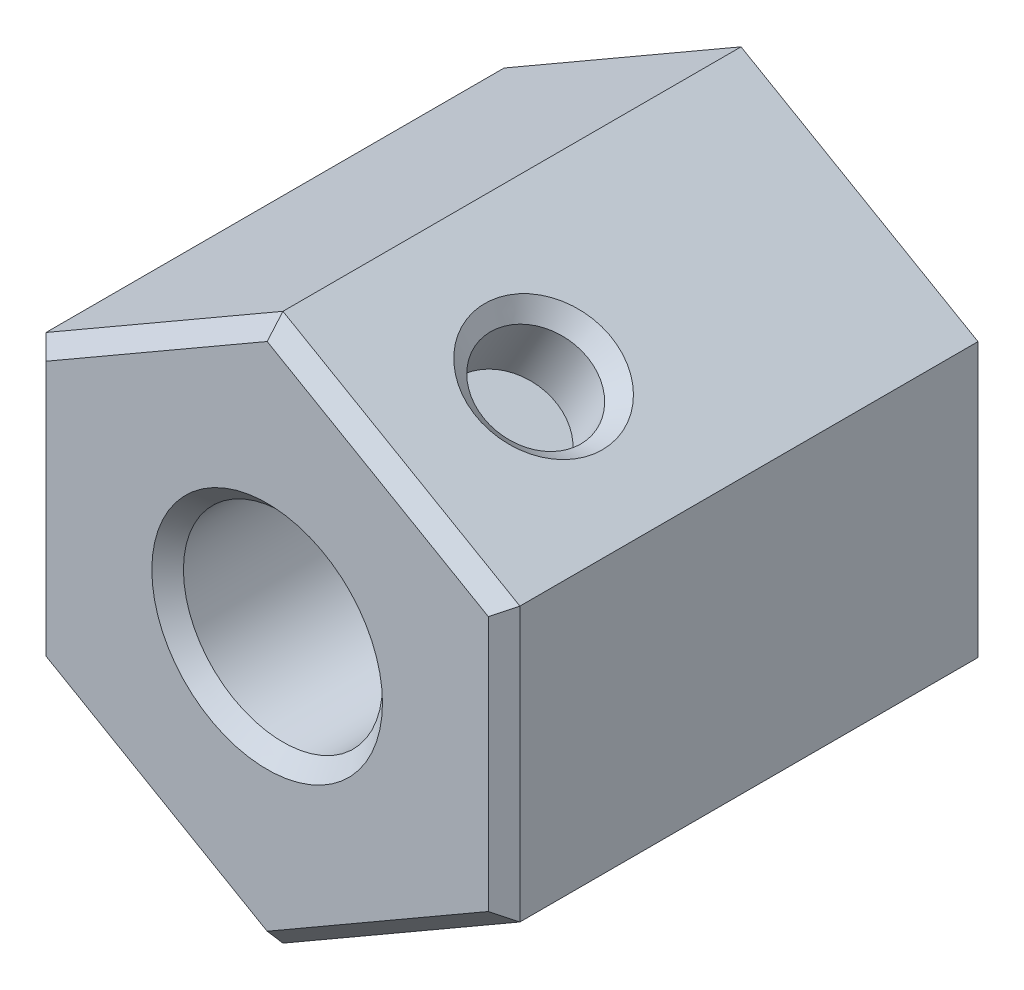
from build123d import *

# Parameters (mm, degrees)
BOSS_EXTRUDE1_DEPTH = 15
SKETCH2_R           = 3.15
CUT_EXTRUDE1_DEPTH  = 15
CUT_EXTRUDE2_DEPTH  = 2.5
SKETCH4_R           = 1.65
CUT_EXTRUDE3_DEPTH  = 2.5
CIRPATTERN1_COUNT   = 3
CHAMFER1_SIZE       = 0.5
CHAMFER2_SIZE       = 0.5
CHAMFER3_SIZE       = 0.5


with BuildPart() as part:
    # Sketch1 → Boss-Extrude1 (new body)
    with BuildSketch(Plane.XY):
        Polygon((0, 8.660254038), (-7.5, 4.330127019), (-7.5, -4.330127019), (0, -8.660254038), (7.5, -4.330127019), (7.5, 4.330127019), align=None)
    extrude(amount=BOSS_EXTRUDE1_DEPTH)

    # Sketch2 → Cut-Extrude1 (cut)
    with BuildSketch(Plane.XY.offset(15)):
        Circle(SKETCH2_R)
    extrude(amount=-CUT_EXTRUDE1_DEPTH, mode=Mode.SUBTRACT)

    # Sketch3 → Cut-Extrude2 (cut)
    with BuildSketch(Plane(origin=(0, 0, 0), x_dir=(-1, 0, 0), z_dir=(0, 0, -1))):
        Polygon((0, 5.888972746), (-5.1, 2.944486373), (-5.1, -2.944486373), (0, -5.888972746), (5.1, -2.944486373), (5.1, 2.944486373), align=None)
    extrude(amount=-CUT_EXTRUDE2_DEPTH, mode=Mode.SUBTRACT)

    # Sketch4 → Cut-Extrude3 (cut)
    with BuildSketch(Plane(origin=(3.75, 6.495190528, 0), x_dir=(0.8660254037844417, -0.4999999999999949, 0), z_dir=(0.4999999999999949, 0.8660254037844417, 0))):
        with Locations((0, -10)):
            Circle(SKETCH4_R)
    cut_extrude3 = extrude(amount=-CUT_EXTRUDE3_DEPTH, mode=Mode.SUBTRACT)

    # CirPattern1: Cut-Extrude3 ×3 about axis
    cirpattern1_axis = Axis((0, 0, 15), (0, 0, 1))
    for i in range(1, CIRPATTERN1_COUNT):
        add(cut_extrude3.rotate(cirpattern1_axis, i * 360 / CIRPATTERN1_COUNT), mode=Mode.SUBTRACT)

    # Chamfer1
    chamfer1_edges = [part.edges().sort_by_distance(p)[0] for p in [
        (7.5, 0, 15),
        (3.75, -6.495190528, 15),
        (-3.75, -6.495190528, 15),
        (-7.5, 0, 15),
        (-3.75, 6.495190528, 15),
        (3.75, 6.495190528, 15),
        (-3.15, 0, 15),
    ]]
    chamfer(chamfer1_edges, length=CHAMFER1_SIZE)

    # Chamfer2
    chamfer2_edges = [part.edges().sort_by_distance(p)[0] for p in [
        (-7.5, -1.65, 10),
        (5.178941916, -5.670190528, 10),
        (2.321058084, 7.320190528, 10),
    ]]
    chamfer(chamfer2_edges, length=CHAMFER2_SIZE)

    # Chamfer3
    chamfer3_edges = [part.edges().sort_by_distance(p)[0] for p in [
        (-3.15, 0, 2.5),
    ]]
    chamfer(chamfer3_edges, length=CHAMFER3_SIZE)


solid = part.part
